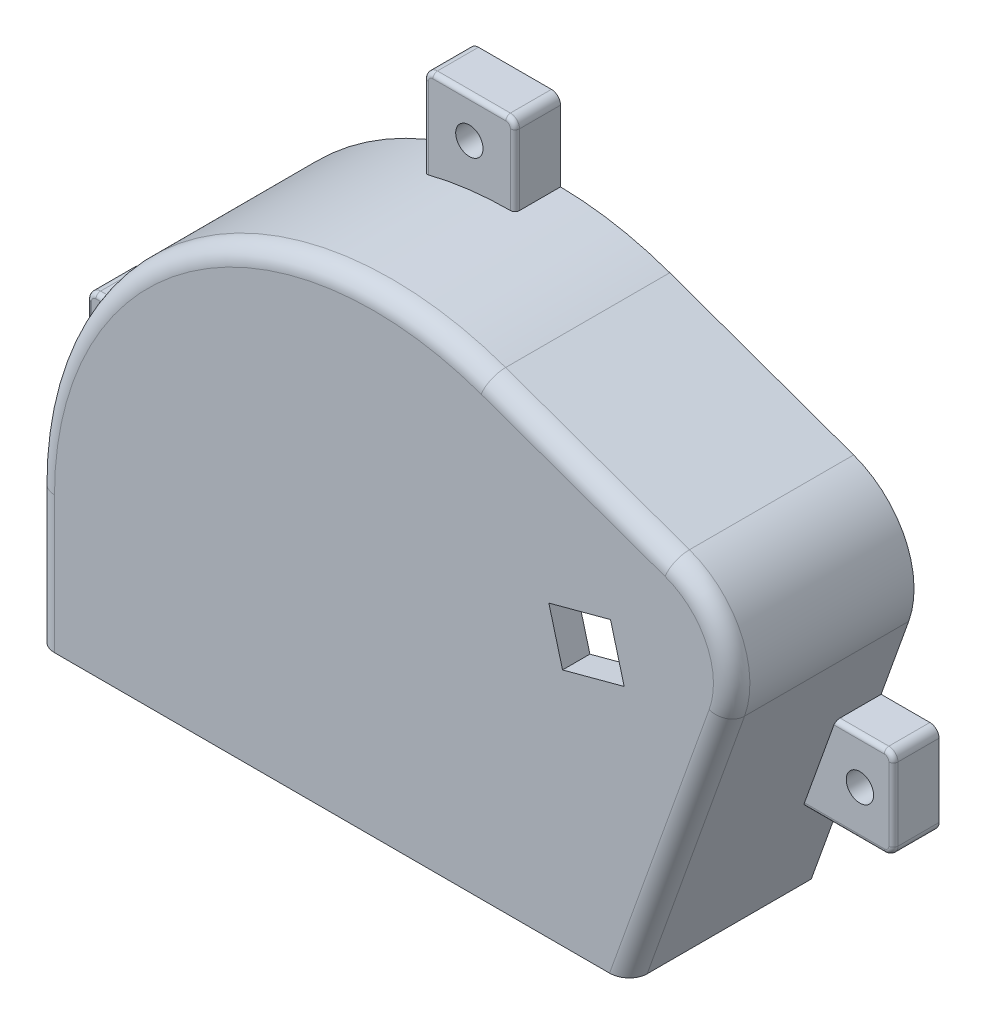
from build123d import *
from build123d.topology import SkipClean

# Parameters (mm, degrees)
BOSS_EXTRU_1_DEPTH      = 20
BOSS_EXTRU_3_START      = -3
BOSS_EXTRU_3_DEPTH      = 3
ENL_V_MAT_EXTRU_3_DEPTH = 3
ENL_V_START             = -15
ENL_V_MAT_EXTRU_4_DEPTH = 15
ESQUISSE10_R            = 1.5
ENL_V_MAT_EXTRU_5_DEPTH = 78.972696085
CONG_1_R                = 2
CONG_2_R                = 0.5


with BuildPart() as part:
    # Esquisse1 → Boss.-Extru.1 (new body)
    with BuildSketch(Plane.XY):
        with BuildLine():
            Line((-32.5, 11.379807046), (-32.5, 0))
            Line((-32.5, 0), (32.5, 0))
            Line((32.5, 0), (36.577501058, 11.379807046))
            Line((36.577501058, 11.379807046), (45.5081781, 11.379807046))
            ThreePointArc((45.5081781, 11.379807046), (46.215284881, 11.672700265), (46.5081781, 12.379807046))
            Line((46.5081781, 12.379807046), (46.5081781, 20.379807046))
            ThreePointArc((46.5081781, 20.379807046), (46.215284881, 21.086913827), (45.5081781, 21.379807046))
            Line((45.5081781, 21.379807046), (40.160603163, 21.379807046))
            Line((40.160603163, 21.379807046), (43.184724439, 29.819759876))
            ThreePointArc((43.184724439, 29.819759876), (42.812595053, 37.46437651), (37.143899579, 42.60680156))
            Line((37.143899579, 42.60680156), (16.980501125, 49.831553104))
            ThreePointArc((16.980501125, 49.831553104), (11.079911293, 51.410228884), (5, 51.996621467))
            Line((5, 51.996621467), (5, 59.759614092))
            ThreePointArc((5, 59.759614092), (4.707106781, 60.466720873), (4, 60.759614092))
            Line((4, 60.759614092), (-4, 60.759614092))
            ThreePointArc((-4, 60.759614092), (-4.707106781, 60.466720873), (-5, 59.759614092))
            Line((-5, 59.759614092), (-5, 50.759614092))
            ThreePointArc((-5, 50.759614092), (-22.768075535, 40.009039498), (-31.945823657, 21.379807046))
            Line((-31.945823657, 21.379807046), (-40.945823657, 21.379807046))
            ThreePointArc((-40.945823657, 21.379807046), (-41.652930438, 21.086913827), (-41.945823657, 20.379807046))
            Line((-41.945823657, 20.379807046), (-41.945823657, 12.379807046))
            ThreePointArc((-41.945823657, 12.379807046), (-41.652930438, 11.672700265), (-40.945823657, 11.379807046))
            Line((-40.945823657, 11.379807046), (-32.5, 11.379807046))
        make_face()
        with BuildLine():
            Line((-27.5, 15), (-27.5, 5))
            Line((-27.5, 5), (28.980274824, 5))
            Line((28.980274824, 5), (38.477757803, 31.506314082))
            ThreePointArc((38.477757803, 31.506314082), (38.29169311, 35.328622399), (35.457345373, 37.899834924))
            Line((35.457345373, 37.899834924), (15.293946919, 45.124586469))
            ThreePointArc((15.293946919, 45.124586469), (-13.920012196, 41.166833028), (-27.5, 15))
        make_face(mode=Mode.SUBTRACT)
    extrude(amount=BOSS_EXTRU_1_DEPTH)

    # Esquisse5 → Boss.-Extru.3 (add)
    with BuildSketch(Plane.XY.offset(20).offset(BOSS_EXTRU_3_START)):
        with BuildLine():
            Line((-32.5, 11.379807046), (-32.5, 0))
            Line((-32.5, 0), (32.5, 0))
            Line((32.5, 0), (36.577501058, 11.379807046))
            Line((36.577501058, 11.379807046), (45.5081781, 11.379807046))
            ThreePointArc((45.5081781, 11.379807046), (46.215284881, 11.672700265), (46.5081781, 12.379807046))
            Line((46.5081781, 12.379807046), (46.5081781, 20.379807046))
            ThreePointArc((46.5081781, 20.379807046), (46.215284881, 21.086913827), (45.5081781, 21.379807046))
            Line((45.5081781, 21.379807046), (40.160603163, 21.379807046))
            Line((40.160603163, 21.379807046), (43.184724439, 29.819759876))
            ThreePointArc((43.184724439, 29.819759876), (42.812595053, 37.46437651), (37.143899579, 42.60680156))
            Line((37.143899579, 42.60680156), (16.980501125, 49.831553104))
            ThreePointArc((16.980501125, 49.831553104), (11.079911293, 51.410228884), (5, 51.996621467))
            Line((5, 51.996621467), (5, 59.759614092))
            ThreePointArc((5, 59.759614092), (4.707106781, 60.466720873), (4, 60.759614092))
            Line((4, 60.759614092), (-4, 60.759614092))
            ThreePointArc((-4, 60.759614092), (-4.707106781, 60.466720873), (-5, 59.759614092))
            Line((-5, 59.759614092), (-5, 50.759614092))
            ThreePointArc((-5, 50.759614092), (-22.768075535, 40.009039498), (-31.945823657, 21.379807046))
            Line((-31.945823657, 21.379807046), (-40.945823657, 21.379807046))
            ThreePointArc((-40.945823657, 21.379807046), (-41.652930438, 21.086913827), (-41.945823657, 20.379807046))
            Line((-41.945823657, 20.379807046), (-41.945823657, 12.379807046))
            ThreePointArc((-41.945823657, 12.379807046), (-41.652930438, 11.672700265), (-40.945823657, 11.379807046))
            Line((-40.945823657, 11.379807046), (-32.5, 11.379807046))
        make_face()
    extrude(amount=BOSS_EXTRU_3_DEPTH)

    # Esquisse6 → Enlèv. mat.-Extru.3 (cut)
    with BuildSketch(Plane(origin=(0, 0, 17), x_dir=(-1, 0, 0), z_dir=(0, 0, -1))):
        Polygon((-30.479635706, 33.638207866), (-23.718154922, 31.82647455), (-25.219305384, 26.224104758), (-31.980786168, 28.035838073), align=None)
    extrude(amount=-ENL_V_MAT_EXTRU_3_DEPTH, mode=Mode.SUBTRACT)

    # Esquisse9 → Enlèv. mat.-Extru.4 (cut)
    with SkipClean():  # the faces are left unmerged after this step: merging them gives an invalid solid
        with BuildSketch(Plane.XY.offset(20).offset(ENL_V_START)):
            with BuildLine():
                Line((5, 51.996621467), (5, 59.759614092))
                ThreePointArc((5, 59.759614092), (4.707106781, 60.466720873), (4, 60.759614092))
                Line((4, 60.759614092), (-4, 60.759614092))
                ThreePointArc((-4, 60.759614092), (-4.707106781, 60.466720873), (-5, 59.759614092))
                Line((-5, 59.759614092), (-5, 50.759614092))
                ThreePointArc((-5, 50.759614092), (-0.042306332, 51.720123273), (5, 51.996621467))
            make_face()
            with BuildLine():
                Line((-31.945823657, 21.379807046), (-40.945823657, 21.379807046))
                ThreePointArc((-40.945823657, 21.379807046), (-41.652930438, 21.086913827), (-41.945823657, 20.379807046))
                Line((-41.945823657, 20.379807046), (-41.945823657, 12.379807046))
                ThreePointArc((-41.945823657, 12.379807046), (-41.652930438, 11.672700265), (-40.945823657, 11.379807046))
                Line((-40.945823657, 11.379807046), (-32.5, 11.379807046))
                Line((-32.5, 11.379807046), (-32.5, 15))
                ThreePointArc((-32.5, 15), (-32.361195554, 18.201915417), (-31.945823657, 21.379807046))
            make_face()
            with BuildLine():
                Line((36.577501058, 11.379807046), (40.160603163, 21.379807046))
                Line((40.160603163, 21.379807046), (45.5081781, 21.379807046))
                ThreePointArc((45.5081781, 21.379807046), (46.215284881, 21.086913827), (46.5081781, 20.379807046))
                Line((46.5081781, 20.379807046), (46.5081781, 12.379807046))
                ThreePointArc((46.5081781, 12.379807046), (46.215284881, 11.672700265), (45.5081781, 11.379807046))
                Line((45.5081781, 11.379807046), (36.577501058, 11.379807046))
            make_face()
        extrude(amount=ENL_V_MAT_EXTRU_4_DEPTH, mode=Mode.SUBTRACT)

    # Esquisse10 → Enlèv. mat.-Extru.5 (cut, through all)
    with SkipClean():  # the faces are left unmerged after this step: merging them gives an invalid solid
        with BuildSketch(Plane.XY.offset(5)):
            with Locations((-37.222911829, 16.379807046)):
                Circle(ESQUISSE10_R)
            with Locations((0, 56.37811778)):
                Circle(ESQUISSE10_R)
            with Locations((42.834390632, 16.379807046)):
                Circle(ESQUISSE10_R)
        extrude(amount=-ENL_V_MAT_EXTRU_5_DEPTH, mode=Mode.SUBTRACT)

    # Congé1
    cong_1_edges = [part.edges().sort_by_distance(p)[0] for p in [
        (-22.768075535, 40.009039498, 20),
        (42.812595053, 37.46437651, 20),
        (-32.5, 5.689903523, 20),
        (38.369052111, 16.379807046, 20),
        (27.062200352, 46.219177332, 20),
    ]]
    fillet(cong_1_edges, radius=CONG_1_R)

    # Congé2
    # the kernel refuses this fillet: 0.5 mm, written as the material it takes off along each edge
    with BuildSketch(Plane(origin=(-40.945823657, 11.379807046, 5), x_dir=(0, 1, 0), z_dir=(1, 0, 0))) as cong_2_piece_1:
        with BuildLine():
            CenterArc((CONG_2_R, -CONG_2_R), CONG_2_R, 90, 90)
            Line((0, -CONG_2_R), (0, 0))
            Line((0, 0), (CONG_2_R, 0))
        make_face()
    extrude(amount=8.445823657, mode=Mode.SUBTRACT)
    with BuildSketch(Plane(origin=(-40.945823657, 12.379807046, 5), x_dir=(-1, 0, 0), z_dir=(0, 1, 0))) as cong_2_piece_2:
        with BuildLine():
            CenterArc((1 - CONG_2_R, -CONG_2_R), CONG_2_R, 0, 90)
            Line((1 - CONG_2_R, 0), (1, 0))
            Line((1, 0), (1, -CONG_2_R))
        make_face()
    revolve(axis=Axis((-40.945823657, 12.379807046, 5), (0, 0, 1)), revolution_arc=90, mode=Mode.SUBTRACT)
    with BuildSketch(Plane(origin=(-41.945823657, 20.379807046, 5), x_dir=(0, 0, -1), z_dir=(0, -1, 0)), Plane(origin=(4, 60.759614092, 5), x_dir=(0, 0, -1), z_dir=(-1, 0, 0))) as cong_2_piece_3:
        with BuildLine():
            CenterArc((CONG_2_R, CONG_2_R), CONG_2_R, 180, 90)
            Line((0, CONG_2_R), (0, 0))
            Line((0, 0), (CONG_2_R, 0))
        make_face()
    extrude(amount=8, mode=Mode.SUBTRACT)
    with BuildSketch(Plane(origin=(-40.945823657, 20.379807046, 5), x_dir=(0, 1, 0), z_dir=(1, 0, 0))) as cong_2_piece_4:
        with BuildLine():
            CenterArc((1 - CONG_2_R, -CONG_2_R), CONG_2_R, 0, 90)
            Line((1 - CONG_2_R, 0), (1, 0))
            Line((1, 0), (1, -CONG_2_R))
        make_face()
    revolve(axis=Axis((-40.945823657, 20.379807046, 5), (0, 0, 1)), revolution_arc=90, mode=Mode.SUBTRACT)
    with BuildSketch(Plane(origin=(-30.695823657, 21.379807046, 5), x_dir=(0, 0, -1), z_dir=(-1, 0, 0))) as cong_2_piece_5_section:
        with BuildLine():
            CenterArc((CONG_2_R, CONG_2_R), CONG_2_R, 180, 90)
            Line((0, CONG_2_R), (0, 0))
            Line((0, 0), (CONG_2_R, 0))
        make_face()
    cong_2_piece_5 = extrude(amount=10.25, mode=Mode.PRIVATE)
    cong_2_piece_5 = cong_2_piece_5 - Plane(origin=(4.5, 15, 4.88667184), x_dir=(-1, 0, 0), z_dir=(0, 0, -1)) * Cylinder(37, 23, mode=Mode.PRIVATE)
    add(cong_2_piece_5, mode=Mode.SUBTRACT)
    with BuildSketch(Plane(origin=(-5, 59.759614092, 5), x_dir=(0, 0, -1), z_dir=(0, -1, 0))) as cong_2_piece_6_section:
        with BuildLine():
            CenterArc((CONG_2_R, CONG_2_R), CONG_2_R, 180, 90)
            Line((0, CONG_2_R), (0, 0))
            Line((0, 0), (CONG_2_R, 0))
        make_face()
    cong_2_piece_6 = extrude(amount=10.25, mode=Mode.PRIVATE)
    cong_2_piece_6 = cong_2_piece_6 - Plane(origin=(4.5, 15, 4.886602511), x_dir=(-1, 0, 0), z_dir=(0, 0, -1)) * Cylinder(37, 23, mode=Mode.PRIVATE)
    add(cong_2_piece_6, mode=Mode.SUBTRACT)
    with BuildSketch(Plane(origin=(-4, 59.759614092, 5), x_dir=(0, 1, 0), z_dir=(1, 0, 0))) as cong_2_piece_7:
        with BuildLine():
            CenterArc((1 - CONG_2_R, -CONG_2_R), CONG_2_R, 0, 90)
            Line((1 - CONG_2_R, 0), (1, 0))
            Line((1, 0), (1, -CONG_2_R))
        make_face()
    revolve(axis=Axis((-4, 59.759614092, 5), (0, 0, 1)), revolution_arc=90, mode=Mode.SUBTRACT)
    with BuildSketch(Plane(origin=(4, 59.759614092, 5), x_dir=(1, 0, 0), z_dir=(0, -1, 0))) as cong_2_piece_8:
        with BuildLine():
            CenterArc((1 - CONG_2_R, -CONG_2_R), CONG_2_R, 0, 90)
            Line((1 - CONG_2_R, 0), (1, 0))
            Line((1, 0), (1, -CONG_2_R))
        make_face()
    revolve(axis=Axis((4, 59.759614092, 5), (0, 0, 1)), revolution_arc=90, mode=Mode.SUBTRACT)
    with BuildSketch(Plane(origin=(5, 50.746621467, 5), x_dir=(0, 0, -1), z_dir=(0, 1, 0))) as cong_2_piece_9_section:
        with BuildLine():
            CenterArc((CONG_2_R, CONG_2_R), CONG_2_R, 180, 90)
            Line((0, CONG_2_R), (0, 0))
            Line((0, 0), (CONG_2_R, 0))
        make_face()
    cong_2_piece_9 = extrude(amount=9.012992625, mode=Mode.PRIVATE)
    cong_2_piece_9 = cong_2_piece_9 - Plane(origin=(4.5, 15, 4.886794032), x_dir=(-1, 0, 0), z_dir=(0, 0, -1)) * Cylinder(37, 21, mode=Mode.PRIVATE)
    add(cong_2_piece_9, mode=Mode.SUBTRACT)
    with BuildSketch(Plane(origin=(38.910603163, 21.379807046, 5), x_dir=(0, -1, 0), z_dir=(1, 0, 0))) as cong_2_piece_10_section:
        with BuildLine():
            CenterArc((CONG_2_R, CONG_2_R), CONG_2_R, 180, 90)
            Line((0, CONG_2_R), (0, 0))
            Line((0, 0), (CONG_2_R, 0))
        make_face()
    cong_2_piece_10 = extrude(amount=6.597574937, mode=Mode.PRIVATE)
    cong_2_piece_10 = split(cong_2_piece_10, bisect_by=Plane(origin=(40.426309442, 22.121360792, 4.88725891), z_dir=(0.9413933271437573, -0.3373108412269116, 0)), keep=Keep.TOP, mode=Mode.PRIVATE)
    add(cong_2_piece_10, mode=Mode.SUBTRACT)
    with BuildSketch(Plane(origin=(45.5081781, 20.379807046, 5), x_dir=(0, 1, 0), z_dir=(-1, 0, 0))) as cong_2_piece_11:
        with BuildLine():
            CenterArc((1 - CONG_2_R, CONG_2_R), CONG_2_R, 270, 90)
            Line((1 - CONG_2_R, 0), (1, 0))
            Line((1, 0), (1, CONG_2_R))
        make_face()
    revolve(axis=Axis((45.5081781, 20.379807046, 5), (0, 0, -1)), revolution_arc=90, mode=Mode.SUBTRACT)
    with BuildSketch(Plane(origin=(46.5081781, 20.379807046, 5), x_dir=(0, 0, -1), z_dir=(0, -1, 0))) as cong_2_piece_12:
        with BuildLine():
            CenterArc((CONG_2_R, -CONG_2_R), CONG_2_R, 90, 90)
            Line((0, -CONG_2_R), (0, 0))
            Line((0, 0), (CONG_2_R, 0))
        make_face()
    extrude(amount=8, mode=Mode.SUBTRACT)
    with BuildSketch(Plane(origin=(45.5081781, 12.379807046, 5), x_dir=(1, 0, 0), z_dir=(0, 1, 0))) as cong_2_piece_13:
        with BuildLine():
            CenterArc((1 - CONG_2_R, CONG_2_R), CONG_2_R, 270, 90)
            Line((1 - CONG_2_R, 0), (1, 0))
            Line((1, 0), (1, CONG_2_R))
        make_face()
    revolve(axis=Axis((45.5081781, 12.379807046, 5), (0, 0, -1)), revolution_arc=90, mode=Mode.SUBTRACT)
    with BuildSketch(Plane(origin=(45.5081781, 11.379807046, 5), x_dir=(0, 0, -1), z_dir=(-1, 0, 0))) as cong_2_piece_14_section:
        with BuildLine():
            CenterArc((CONG_2_R, -CONG_2_R), CONG_2_R, 90, 90)
            Line((0, -CONG_2_R), (0, 0))
            Line((0, 0), (CONG_2_R, 0))
        make_face()
    cong_2_piece_14 = extrude(amount=10.180677042, mode=Mode.PRIVATE)
    cong_2_piece_14 = split(cong_2_piece_14, bisect_by=Plane(origin=(37.123655208, 12.904056519, 4.886525787), z_dir=(0.9413933271437573, -0.3373108412269116, 0)), keep=Keep.TOP, mode=Mode.PRIVATE)
    add(cong_2_piece_14, mode=Mode.SUBTRACT)


solid = part.part
